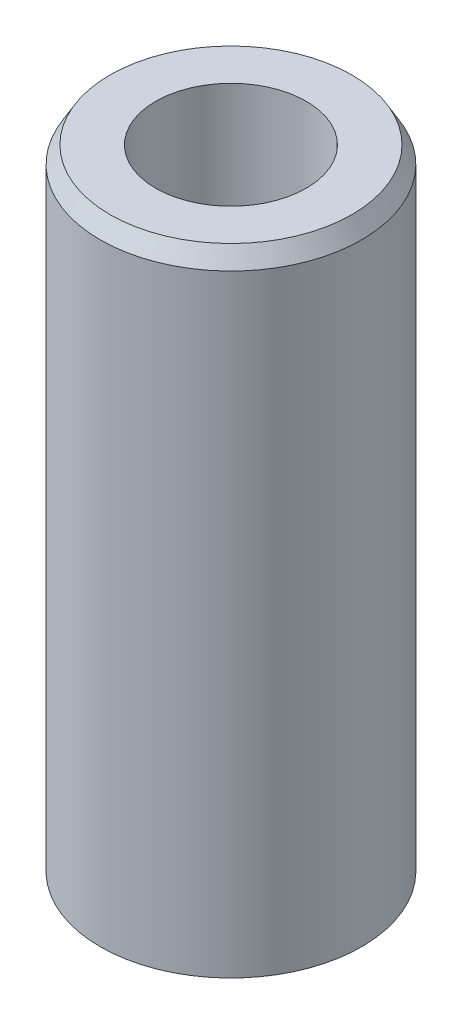
from build123d import *
from OCP.BRepFilletAPI import BRepFilletAPI_MakeChamfer

# Parameters (mm, degrees)
SKETCH1_R           = 40
BOSS_EXTRUDE1_DEPTH = 195.481030939
SKETCH2_R           = 23.045826851
CUT_EXTRUDE1_DEPTH  = 204.50143355
CHAMFER1_SIZE       = 5.18428674
CHAMFER1_SIZE2      = 2.993149345


with BuildPart() as part:
    # Sketch1 → Boss-Extrude1 (new body)
    with BuildSketch(Plane(origin=(0, 0, 0), x_dir=(1, 0, 0), z_dir=(0, 1, 0))):
        Circle(SKETCH1_R)
    extrude(amount=BOSS_EXTRUDE1_DEPTH)

    # Sketch2 → Cut-Extrude1 (cut, through all)
    with BuildSketch(Plane(origin=(0, 0, 0), x_dir=(1, 0, 0), z_dir=(0, 1, 0))):
        Circle(SKETCH2_R)
    extrude(amount=CUT_EXTRUDE1_DEPTH, mode=Mode.SUBTRACT)

    # Chamfer1: one chamfer whose edges measure the first distance from different faces: ONE call of the kernel's chamfer builder (chamfer() names one face for all edges)
    chamfer1_edges_1 = [part.edges().sort_by_distance(p)[0] for p in [
        (-40, 195.481030939, 0),
    ]]
    chamfer1_side_1 = [part.faces().sort_by_distance(p)[0] for p in [
        (-40, 97.74051547, 0),
    ]]
    chamfer1_edges_2 = [part.edges().sort_by_distance(p)[0] for p in [
        (-40, 0, 0),
    ]]
    chamfer1_side_2 = [part.faces().sort_by_distance(p)[0] for p in [
        (-38.86862915, 0, 0),
    ]]
    chamfer1 = BRepFilletAPI_MakeChamfer(part.part.solid().wrapped)
    for e in chamfer1_edges_1:
        chamfer1.Add(CHAMFER1_SIZE, CHAMFER1_SIZE2, e.wrapped, chamfer1_side_1[0].wrapped)  # the first distance lies on this face
    for e in chamfer1_edges_2:
        chamfer1.Add(CHAMFER1_SIZE, CHAMFER1_SIZE2, e.wrapped, chamfer1_side_2[0].wrapped)  # the first distance lies on this face
    add(Compound.cast(chamfer1.Shape()), mode=Mode.REPLACE)


solid = part.part
